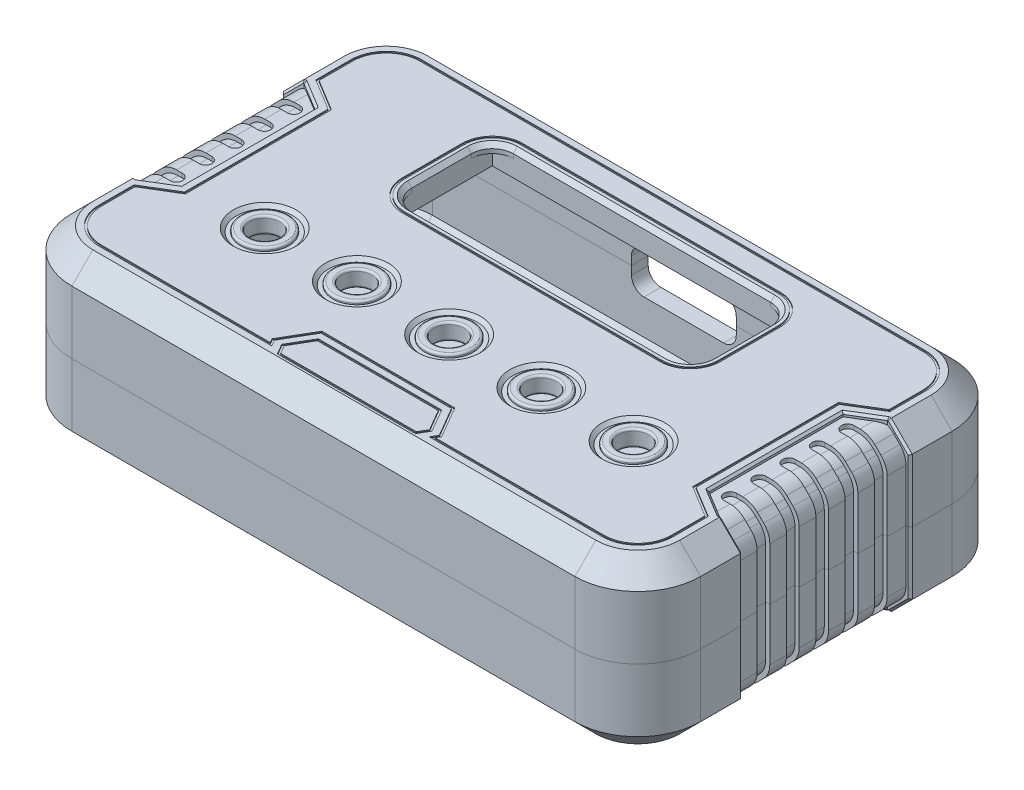
from build123d import *
from OCP.BRepFilletAPI import BRepFilletAPI_MakeChamfer

# Parameters (mm, degrees)
SKETCH1_W               = 150
SKETCH1_H               = 90
BOSS_EXTRUDE1_DEPTH     = 40
FILLET1_R               = 15
CHAMFER1_SIZE           = 5
SHELL7_T                = 4
CUT_EXTRUDE1_DEPTH      = 20
CUT_EXTRUDE2_DEPTH      = 1.5
FILLET2_R               = 1.5
FILLET4_R               = 1.5
LPATTERN1_COUNT         = 3
LPATTERN1_PITCH         = 7
FILLET2_OF_LPATTERN1_R  = 1.5
FILLET4_OF_LPATTERN1_R  = 1.5
LPATTERN2_COUNT         = 3
LPATTERN2_PITCH         = 7
FILLET2_OF_LPATTERN2_R  = 1.5
FILLET4_OF_LPATTERN2_R  = 1.5
CHAMFER5_SIZE           = 6.59
CHAMFER5_SIZE2          = 4
CHAMFER6_SIZE           = 4
CHAMFER6_SIZE2          = 6.59
CHAMFER7_SIZE           = 0.5
CUT_EXTRUDE_THIN2_DEPTH = 0.25
CUT_EXTRUDE_THIN3_DEPTH = 0.25
CUT_EXTRUDE3_REACH      = 125.794
CUT_EXTRUDE4_REACH      = 98.177
SKETCH18_W              = 71.4
SKETCH18_H              = 24.2
SKETCH18_R              = 3.6
FILLET16_R              = 5
CUT_EXTRUDE7_START      = -2
SKETCH18_6_W            = 71.4
SKETCH18_6_H            = 24.2
CUT_EXTRUDE7_DEPTH      = 10
BOSS_EXTRUDE5_START     = -4
SKETCH18_7_W            = 75.4
SKETCH18_7_H            = 28.2
SKETCH18_7_W_2          = 71.4
SKETCH18_7_H_2          = 24.2
BOSS_EXTRUDE5_DEPTH     = 2
CHAMFER8_SIZE           = 1
CUT_EXTRUDE_THIN4_DEPTH = 0.25
FILLET13_R              = 5
FILLET14_R              = 0.5
SKETCH23_R              = 7.5
SKETCH23_R_2            = 5.75
CUT_EXTRUDE10_DEPTH     = 0.8
FILLET17_R              = 0.5
CHAMFER9_SIZE           = 0.8


# Read off the part's stored shape, not the designer's step: Mirror12
with BuildPart() as part:
    # Sketch1 → Boss-Extrude1 (new body)
    with BuildSketch(Plane(origin=(0, 0, 0), x_dir=(1, 0, 0), z_dir=(0, 1, 0))):
        Rectangle(SKETCH1_W, SKETCH1_H)
    extrude(amount=BOSS_EXTRUDE1_DEPTH)

    # Fillet1
    fillet1_edges = [part.edges().sort_by_distance(p)[0] for p in [
        (75, 20, 45),
        (-75, 20, 45),
        (-75, 20, -45),
        (75, 20, -45),
    ]]
    fillet(fillet1_edges, radius=FILLET1_R)

    # Chamfer1
    chamfer1_edges = [part.edges().sort_by_distance(p)[0] for p in [
        (-75, 0, 0),
        (-75, 40, 0),
        (75, 0, 0),
        (0, 0, 45),
        (0, 0, -45),
        (-70.606601718, 0, 40.606601718),
        (70.606601718, 0, 40.606601718),
        (70.606601718, 0, -40.606601718),
        (-70.606601718, 0, -40.606601718),
        (0, 40, -45),
        (75, 40, 0),
        (0, 40, 45),
        (-70.606601718, 40, 40.606601718),
        (70.606601718, 40, 40.606601718),
        (70.606601718, 40, -40.606601718),
        (-70.606601718, 40, -40.606601718),
    ]]
    chamfer(chamfer1_edges, length=CHAMFER1_SIZE)

    # Shell7 (no face opened: a closed hollow body)
    add(offset(amount=-SHELL7_T, mode=Mode.PRIVATE), mode=Mode.SUBTRACT)

    # Sketch3 → Cut-Extrude1 (cut, symmetric)
    with BuildSketch(Plane.XY):
        Polygon((70, 40), (63, 40), (63, 39), (69.585786438, 39), (74, 34.585786438), (74, 5.414213562), (69.585786438, 1), (63, 1), (63, 0), (70, 0), (75, 5), (75, 35), align=None)
    extrude(amount=CUT_EXTRUDE1_DEPTH, both=True, mode=Mode.SUBTRACT)

    # Sketch12 → Cut-Extrude2 (cut, symmetric)
    with BuildSketch(Plane.XY):
        Polygon((69.585786438, 39), (64.585, 39), (64.585, 38), (69.171572875, 38), (73, 34.171572875), (73, 5.828427125), (69.171572875, 2), (64.585, 2), (64.585, 1), (69.585786438, 1), (74, 5.414213562), (74, 34.585786438), align=None)
    cut_extrude2 = extrude(amount=CUT_EXTRUDE2_DEPTH, both=True, mode=Mode.SUBTRACT)

    # Fillet2
    fillet2_edges = [part.edges().sort_by_distance(p)[0] for p in [
        (64.585, 38.5, -1.5),
        (64.585, 38.5, 1.5),
    ]]
    fillet(fillet2_edges, radius=FILLET2_R - 0.0001)  # a hair under: the kernel refuses the full size

    # Fillet4
    fillet4_edges = [part.edges().sort_by_distance(p)[0] for p in [
        (64.585, 1.5, -1.5),
        (64.585, 1.5, 1.5),
    ]]
    fillet(fillet4_edges, radius=FILLET4_R - 0.0001)  # a hair under: the kernel refuses the full size

    # LPattern1: Cut-Extrude2 ×3
    with Locations(*[(0, 0, i * LPATTERN1_PITCH) for i in range(1, LPATTERN1_COUNT)]):
        add(cut_extrude2, mode=Mode.SUBTRACT)

    # Fillet2 of LPattern1
    fillet2_of_lpattern1_edges = [part.edges().sort_by_distance(p)[0] for p in [
        (64.585, 38.5, 5.5),
        (64.585, 38.5, 8.5),
        (64.585, 38.5, 12.5),
        (64.585, 38.5, 15.5),
    ]]
    fillet(fillet2_of_lpattern1_edges, radius=FILLET2_OF_LPATTERN1_R - 0.0001)  # a hair under: the kernel refuses the full size

    # Fillet4 of LPattern1
    fillet4_of_lpattern1_edges = [part.edges().sort_by_distance(p)[0] for p in [
        (64.585, 1.5, 5.5),
        (64.585, 1.5, 8.5),
        (64.585, 1.5, 12.5),
        (64.585, 1.5, 15.5),
    ]]
    fillet(fillet4_of_lpattern1_edges, radius=FILLET4_OF_LPATTERN1_R - 0.0001)  # a hair under: the kernel refuses the full size

    # LPattern2: Cut-Extrude2 ×3
    with Locations(*[(0, 0, -i * LPATTERN2_PITCH) for i in range(1, LPATTERN2_COUNT)]):
        add(cut_extrude2, mode=Mode.SUBTRACT)

    # Fillet2 of LPattern2
    fillet2_of_lpattern2_edges = [part.edges().sort_by_distance(p)[0] for p in [
        (64.585, 38.5, -8.5),
        (64.585, 38.5, -5.5),
        (64.585, 38.5, -15.5),
        (64.585, 38.5, -12.5),
    ]]
    fillet(fillet2_of_lpattern2_edges, radius=FILLET2_OF_LPATTERN2_R - 0.0001)  # a hair under: the kernel refuses the full size

    # Fillet4 of LPattern2
    fillet4_of_lpattern2_edges = [part.edges().sort_by_distance(p)[0] for p in [
        (64.585, 1.5, -8.5),
        (64.585, 1.5, -5.5),
        (64.585, 1.5, -15.5),
        (64.585, 1.5, -12.5),
    ]]
    fillet(fillet4_of_lpattern2_edges, radius=FILLET4_OF_LPATTERN2_R - 0.0001)  # a hair under: the kernel refuses the full size

    # Mirror12
    split(bisect_by=Plane(origin=(0, 0, 0), x_dir=(0, 0, 1), z_dir=(1, 0, 0)), keep=Keep.TOP)

    # Mirror12 2: part across plane


with BuildPart() as part_1:
    add(part.part)
    add(part.part.mirror(Plane(origin=(0, 0, 0), x_dir=(0, 0, 1), z_dir=(1, 0, 0))))

    # Chamfer5: one chamfer whose edges measure the first distance from different faces: ONE call of the kernel's chamfer builder (chamfer() names one face for all edges)
    chamfer5_edges_1 = [part_1.edges().sort_by_distance(p)[0] for p in [
        (-63, 39.5, -20),
        (-63, 0.5, -20),
    ]]
    chamfer5_side_1 = [part_1.faces().sort_by_distance(p)[0] for p in [
        (-74.58238774, 20, -20),
    ]]
    chamfer5_edges_2 = [part_1.edges().sort_by_distance(p)[0] for p in [
        (63, 0.5, 20),
        (63, 39.5, 20),
    ]]
    chamfer5_side_2 = [part_1.faces().sort_by_distance(p)[0] for p in [
        (74.58238774, 20, 20),
    ]]
    chamfer5 = BRepFilletAPI_MakeChamfer(part_1.part.solid().wrapped)
    for e in chamfer5_edges_1:
        chamfer5.Add(CHAMFER5_SIZE, CHAMFER5_SIZE2, e.wrapped, chamfer5_side_1[0].wrapped)  # the first distance lies on this face
    for e in chamfer5_edges_2:
        chamfer5.Add(CHAMFER5_SIZE, CHAMFER5_SIZE2, e.wrapped, chamfer5_side_2[0].wrapped)  # the first distance lies on this face
    add(Compound.cast(chamfer5.Shape()), mode=Mode.REPLACE)

    # Chamfer6: one chamfer whose edges measure the first distance from different faces: ONE call of the kernel's chamfer builder (chamfer() names one face for all edges)
    chamfer6_edges_1 = [part_1.edges().sort_by_distance(p)[0] for p in [
        (-63, 0.5, 20),
    ]]
    chamfer6_side_1 = [part_1.faces().sort_by_distance(p)[0] for p in [
        (-63, 0.5, 2),
    ]]
    chamfer6_edges_2 = [part_1.edges().sort_by_distance(p)[0] for p in [
        (-63, 39.5, 20),
    ]]
    chamfer6_side_2 = [part_1.faces().sort_by_distance(p)[0] for p in [
        (-63, 39.5, 2),
    ]]
    chamfer6_edges_3 = [part_1.edges().sort_by_distance(p)[0] for p in [
        (63, 39.5, -20),
    ]]
    chamfer6_side_3 = [part_1.faces().sort_by_distance(p)[0] for p in [
        (63, 39.5, -2),
    ]]
    chamfer6_edges_4 = [part_1.edges().sort_by_distance(p)[0] for p in [
        (63, 0.5, -20),
    ]]
    chamfer6_side_4 = [part_1.faces().sort_by_distance(p)[0] for p in [
        (63, 0.5, -2),
    ]]
    chamfer6 = BRepFilletAPI_MakeChamfer(part_1.part.solid().wrapped)
    for e in chamfer6_edges_1:
        chamfer6.Add(CHAMFER6_SIZE, CHAMFER6_SIZE2, e.wrapped, chamfer6_side_1[0].wrapped)  # the first distance lies on this face
    for e in chamfer6_edges_2:
        chamfer6.Add(CHAMFER6_SIZE, CHAMFER6_SIZE2, e.wrapped, chamfer6_side_2[0].wrapped)  # the first distance lies on this face
    for e in chamfer6_edges_3:
        chamfer6.Add(CHAMFER6_SIZE, CHAMFER6_SIZE2, e.wrapped, chamfer6_side_3[0].wrapped)  # the first distance lies on this face
    for e in chamfer6_edges_4:
        chamfer6.Add(CHAMFER6_SIZE, CHAMFER6_SIZE2, e.wrapped, chamfer6_side_4[0].wrapped)  # the first distance lies on this face
    add(Compound.cast(chamfer6.Shape()), mode=Mode.REPLACE)

    # Chamfer7
    chamfer7_edges = [part_1.edges().sort_by_distance(p)[0] for p in [
        (72.5, 37.5, 20),
        (75, 20, 20),
        (72.5, 2.5, 20),
        (69.795, 0, 20),
        (72.5, 37.5, -20),
        (75, 20, -20),
        (72.5, 2.5, -20),
        (69.795, 0, -20),
        (-69.795, 0, -20),
        (-72.5, 2.5, -20),
        (-75, 20, -20),
        (-72.5, 37.5, -20),
        (-72.5, 37.5, 20),
        (-75, 20, 20),
        (-72.5, 2.5, 20),
        (-69.795, 0, 20),
        (-63, 40, 0),
        (-69.795, 40, -20),
        (-63, 0, 0),
        (69.795, 40, 20),
        (-66.295, 40, -18),
        (-66.295, 0, -18),
        (66.295, 0, 18),
        (66.295, 40, 18),
        (-69.795, 40, 20),
        (69.795, 40, -20),
        (63, 40, 0),
        (63, 0, 0),
        (-66.295, 0, 18),
        (-66.295, 40, 18),
        (66.295, 40, -18),
        (66.295, 0, -18),
    ]]
    chamfer(chamfer7_edges, length=CHAMFER7_SIZE)

    # Sketch15 → Cut-Extrude-Thin2 (cut, symmetric)
    with BuildSketch(Plane(origin=(0, 40, 0), x_dir=(1, 0, 0), z_dir=(0, 1, 0))):
        Polygon((-14.712814834, -31.5), (14.712814834, -31.5), (17.921148167, -37), (16.462814834, -39.5), (-16.462814834, -39.5), (-17.921148167, -37), align=None)
        Polygon((-14.425629668, -32), (14.425629668, -32), (17.342296334, -37), (16.175629668, -39), (-16.175629668, -39), (-17.342296334, -37), align=None, mode=Mode.SUBTRACT)
    extrude(amount=CUT_EXTRUDE_THIN2_DEPTH, both=True, mode=Mode.SUBTRACT)

    # Sketch16 → Cut-Extrude-Thin3 (cut, symmetric)
    with BuildSketch(Plane(origin=(0, 40, 0), x_dir=(1, 0, 0), z_dir=(0, 1, 0))):
        with BuildLine():
            Line((60, 38.5), (-60, 38.5))
            ThreePointArc((-60, 38.5), (-66.01040764, 36.01040764), (-68.5, 30))
            Line((-68.5, 30), (-68.5, 21.677985529))
            Line((-68.5, 21.677985529), (-61, 17.12563348))
            Line((-61, 17.12563348), (-61, -17.12563348))
            Line((-61, -17.12563348), (-68.5, -21.677985529))
            Line((-68.5, -21.677985529), (-68.5, -30))
            ThreePointArc((-68.5, -30), (-66.01040764, -36.01040764), (-60, -38.5))
            Line((-60, -38.5), (-18.782703666, -38.5))
            Line((-18.782703666, -38.5), (-19.657703666, -37))
            Line((-19.657703666, -37), (-15.574370332, -30))
            Line((-15.574370332, -30), (15.574370332, -30))
            Line((15.574370332, -30), (19.657703666, -37))
            Line((19.657703666, -37), (18.782703666, -38.5))
            Line((18.782703666, -38.5), (60, -38.5))
            ThreePointArc((60, -38.5), (66.01040764, -36.01040764), (68.5, -30))
            Line((68.5, -30), (68.5, -21.677985529))
            Line((68.5, -21.677985529), (61, -17.12563348))
            Line((61, -17.12563348), (61, 17.12563348))
            Line((61, 17.12563348), (68.5, 21.677985529))
            Line((68.5, 21.677985529), (68.5, 30))
            ThreePointArc((68.5, 30), (66.01040764, 36.01040764), (60, 38.5))
        make_face()
        with BuildLine():
            Line((60, 38), (-60, 38))
            ThreePointArc((-60, 38), (-65.656854249, 35.656854249), (-68, 30))
            Line((-68, 30), (-68, 21.959393899))
            Line((-68, 21.959393899), (-60.5, 17.40704185))
            Line((-60.5, 17.40704185), (-60.5, -17.40704185))
            Line((-60.5, -17.40704185), (-68, -21.959393899))
            Line((-68, -21.959393899), (-68, -30))
            ThreePointArc((-68, -30), (-65.656854249, -35.656854249), (-60, -38))
            Line((-60, -38), (-19.653222165, -38))
            Line((-19.653222165, -38), (-20.236555499, -37))
            Line((-20.236555499, -37), (-15.861555499, -29.5))
            Line((-15.861555499, -29.5), (15.861555499, -29.5))
            Line((15.861555499, -29.5), (20.236555499, -37))
            Line((20.236555499, -37), (19.653222165, -38))
            Line((19.653222165, -38), (60, -38))
            ThreePointArc((60, -38), (65.656854249, -35.656854249), (68, -30))
            Line((68, -30), (68, -21.959393899))
            Line((68, -21.959393899), (60.5, -17.40704185))
            Line((60.5, -17.40704185), (60.5, 17.40704185))
            Line((60.5, 17.40704185), (68, 21.959393899))
            Line((68, 21.959393899), (68, 30))
            ThreePointArc((68, 30), (65.656854249, 35.656854249), (60, 38))
        make_face(mode=Mode.SUBTRACT)
    extrude(amount=CUT_EXTRUDE_THIN3_DEPTH, both=True, mode=Mode.SUBTRACT)

    # Sketch17 → Cut-Extrude3 (cut, up to next)
    with BuildSketch(Plane(origin=(0, 0, -45), x_dir=(-1, 0, 0), z_dir=(0, 0, -1)), mode=Mode.PRIVATE) as cut_extrude3_sk1:
        with BuildLine():
            Line((-9.5, 15), (9.5, 15))
            ThreePointArc((9.5, 15), (11.621320344, 15.878679656), (12.5, 18))
            Line((12.5, 18), (12.5, 22))
            ThreePointArc((12.5, 22), (11.621320344, 24.121320344), (9.5, 25))
            Line((9.5, 25), (-9.5, 25))
            ThreePointArc((-9.5, 25), (-11.621320344, 24.121320344), (-12.5, 22))
            Line((-12.5, 22), (-12.5, 18))
            ThreePointArc((-12.5, 18), (-11.621320344, 15.878679656), (-9.5, 15))
        make_face()
    cut_extrude3_tool1 = extrude(cut_extrude3_sk1.sketch, amount=-CUT_EXTRUDE3_REACH, mode=Mode.PRIVATE) & part_1.part
    add(cut_extrude3_tool1.solids().sort_by_distance((0, 20, -45))[0], mode=Mode.SUBTRACT)

    # Sketch18 → Cut-Extrude4 (cut, up to next)
    with BuildSketch(Plane(origin=(0, 40, 0), x_dir=(1, 0, 0), z_dir=(0, 1, 0)), mode=Mode.PRIVATE) as cut_extrude4_sk1:
        with Locations((0, 18.9)):
            Rectangle(SKETCH18_W, SKETCH18_H)
    cut_extrude4_tool1 = extrude(cut_extrude4_sk1.sketch, amount=-CUT_EXTRUDE4_REACH, mode=Mode.PRIVATE) & part_1.part
    # Sketch18 → Cut-Extrude4 (cut, up to next)
    with BuildSketch(Plane(origin=(0, 40, 0), x_dir=(1, 0, 0), z_dir=(0, 1, 0)), mode=Mode.PRIVATE) as cut_extrude4_sk2:
        with Locations(Location((-44, -15, 0), (0, 0, 270))):
            Circle(SKETCH18_R)
    cut_extrude4_tool2 = extrude(cut_extrude4_sk2.sketch, amount=-CUT_EXTRUDE4_REACH, mode=Mode.PRIVATE) & part_1.part
    # Sketch18 → Cut-Extrude4 (cut, up to next)
    with BuildSketch(Plane(origin=(0, 40, 0), x_dir=(1, 0, 0), z_dir=(0, 1, 0)), mode=Mode.PRIVATE) as cut_extrude4_sk3:
        with Locations(Location((-22, -15, 0), (0, 0, 270))):
            Circle(SKETCH18_R)
    cut_extrude4_tool3 = extrude(cut_extrude4_sk3.sketch, amount=-CUT_EXTRUDE4_REACH, mode=Mode.PRIVATE) & part_1.part
    # Sketch18 → Cut-Extrude4 (cut, up to next)
    with BuildSketch(Plane(origin=(0, 40, 0), x_dir=(1, 0, 0), z_dir=(0, 1, 0)), mode=Mode.PRIVATE) as cut_extrude4_sk4:
        with Locations(Location((0, -15, 0), (0, 0, 270))):
            Circle(SKETCH18_R)
    cut_extrude4_tool4 = extrude(cut_extrude4_sk4.sketch, amount=-CUT_EXTRUDE4_REACH, mode=Mode.PRIVATE) & part_1.part
    # Sketch18 → Cut-Extrude4 (cut, up to next)
    with BuildSketch(Plane(origin=(0, 40, 0), x_dir=(1, 0, 0), z_dir=(0, 1, 0)), mode=Mode.PRIVATE) as cut_extrude4_sk5:
        with Locations(Location((22, -15, 0), (0, 0, 270))):
            Circle(SKETCH18_R)
    cut_extrude4_tool5 = extrude(cut_extrude4_sk5.sketch, amount=-CUT_EXTRUDE4_REACH, mode=Mode.PRIVATE) & part_1.part
    # Sketch18 → Cut-Extrude4 (cut, up to next)
    with BuildSketch(Plane(origin=(0, 40, 0), x_dir=(1, 0, 0), z_dir=(0, 1, 0)), mode=Mode.PRIVATE) as cut_extrude4_sk6:
        with Locations(Location((44, -15, 0), (0, 0, 270))):
            Circle(SKETCH18_R)
    cut_extrude4_tool6 = extrude(cut_extrude4_sk6.sketch, amount=-CUT_EXTRUDE4_REACH, mode=Mode.PRIVATE) & part_1.part
    add(cut_extrude4_tool1.solids().sort_by_distance((0, 40, -18.9))[0], mode=Mode.SUBTRACT)
    add(cut_extrude4_tool2.solids().sort_by_distance((-44, 40, 15))[0], mode=Mode.SUBTRACT)
    add(cut_extrude4_tool3.solids().sort_by_distance((-22, 40, 15))[0], mode=Mode.SUBTRACT)
    add(cut_extrude4_tool4.solids().sort_by_distance((0, 40, 15))[0], mode=Mode.SUBTRACT)
    add(cut_extrude4_tool5.solids().sort_by_distance((22, 40, 15))[0], mode=Mode.SUBTRACT)
    add(cut_extrude4_tool6.solids().sort_by_distance((44, 40, 15))[0], mode=Mode.SUBTRACT)

    # Fillet16
    fillet16_edges = [part_1.edges().sort_by_distance(p)[0] for p in [
        (-35.7, 38, -6.8),
        (-35.7, 38, -31),
        (35.7, 38, -31),
        (35.7, 38, -6.8),
    ]]
    fillet(fillet16_edges, radius=FILLET16_R)

    # Sketch18<6> → Cut-Extrude7 (cut)
    with BuildSketch(Plane(origin=(0, 40, 0), x_dir=(1, 0, 0), z_dir=(0, 1, 0)).offset(CUT_EXTRUDE7_START)):
        with Locations((0, 18.9)):
            Rectangle(SKETCH18_6_W, SKETCH18_6_H)
    extrude(amount=-CUT_EXTRUDE7_DEPTH, mode=Mode.SUBTRACT)

    # Sketch18<7> → Boss-Extrude5 (add)
    with BuildSketch(Plane(origin=(0, 40, 0), x_dir=(1, 0, 0), z_dir=(0, 1, 0)).offset(BOSS_EXTRUDE5_START)):
        with Locations((0, 18.9)):
            Rectangle(SKETCH18_7_W, SKETCH18_7_H)
        with Locations((0, 18.9)):
            Rectangle(SKETCH18_7_W_2, SKETCH18_7_H_2, mode=Mode.SUBTRACT)
    extrude(amount=-BOSS_EXTRUDE5_DEPTH)

    # Chamfer8
    chamfer8_edges = [part_1.edges().sort_by_distance(p)[0] for p in [
        (35.7, 40, -18.9),
        (0, 40, -6.8),
        (0, 40, -31),
        (-35.7, 40, -18.9),
        (34.235533906, 40, -8.264466094),
        (34.235533906, 40, -29.535533906),
        (-34.235533906, 40, -8.264466094),
        (-34.235533906, 40, -29.535533906),
    ]]
    chamfer(chamfer8_edges, length=CHAMFER8_SIZE)

    # Sketch26 → Cut-Extrude-Thin4 (cut)
    with BuildSketch(Plane(origin=(0, 40, 0), x_dir=(1, 0, 0), z_dir=(0, 1, 0))):
        with BuildLine():
            Line((-37.95, 11.8), (-37.95, 26))
            ThreePointArc((-37.95, 26), (-35.826524164, 31.126524164), (-30.7, 33.25))
            Line((-30.7, 33.25), (30.7, 33.25))
            ThreePointArc((30.7, 33.25), (35.826524164, 31.126524164), (37.95, 26))
            Line((37.95, 26), (37.95, 11.8))
            ThreePointArc((37.95, 11.8), (35.826524164, 6.673475836), (30.7, 4.55))
            Line((30.7, 4.55), (-30.7, 4.55))
            ThreePointArc((-30.7, 4.55), (-35.826524164, 6.673475836), (-37.95, 11.8))
        make_face()
        with BuildLine():
            Line((-37.45, 11.8), (-37.45, 26))
            ThreePointArc((-37.45, 26), (-35.472970773, 30.772970773), (-30.7, 32.75))
            Line((-30.7, 32.75), (30.7, 32.75))
            ThreePointArc((30.7, 32.75), (35.472970773, 30.772970773), (37.45, 26))
            Line((37.45, 26), (37.45, 11.8))
            ThreePointArc((37.45, 11.8), (35.472970773, 7.027029227), (30.7, 5.05))
            Line((30.7, 5.05), (-30.7, 5.05))
            ThreePointArc((-30.7, 5.05), (-35.472970773, 7.027029227), (-37.45, 11.8))
        make_face(mode=Mode.SUBTRACT)
    extrude(amount=-CUT_EXTRUDE_THIN4_DEPTH, mode=Mode.SUBTRACT)

    # Fillet13
    fillet13_edges = [part_1.edges().sort_by_distance(p)[0] for p in [
        (69.585786438, 1, -17.748721225),
        (69.585786438, 1, -10.5),
        (69.585786438, 1, -3.5),
        (69.585786438, 1, 3.5),
        (69.585786438, 1, 10.5),
        (69.585786438, 1, 17.748721225),
        (74, 5.414213562, 17.75),
        (74, 5.414213562, 10.5),
        (74, 5.414213562, 3.5),
        (74, 5.414213562, -3.5),
        (74, 5.414213562, -10.5),
        (74, 5.414213562, -17.75),
        (74, 34.585786438, 17.75),
        (74, 34.585786438, 10.5),
        (74, 34.585786438, 3.5),
        (74, 34.585786438, -3.5),
        (74, 34.585786438, -10.5),
        (74, 34.585786438, -17.75),
        (69.585786438, 39, 17.748721225),
        (69.585786438, 39, 10.5),
        (69.585786438, 39, 3.5),
        (69.585786438, 39, -3.5),
        (69.585786438, 39, -10.5),
        (69.585786438, 39, -17.748721225),
        (-74, 5.414213562, 17.75),
        (-69.585786438, 1, 17.748721225),
        (-74, 5.414213562, 10.5),
        (-69.585786438, 1, 10.5),
        (-74, 5.414213562, 3.5),
        (-69.585786438, 1, 3.5),
        (-74, 5.414213562, -3.5),
        (-69.585786438, 1, -3.5),
        (-74, 5.414213562, -10.5),
        (-69.585786438, 1, -10.5),
        (-69.585786438, 1, -17.748721225),
        (-74, 5.414213562, -17.75),
        (-74, 34.585786438, -17.75),
        (-74, 34.585786438, -10.5),
        (-74, 34.585786438, -3.5),
        (-74, 34.585786438, 3.5),
        (-74, 34.585786438, 10.5),
        (-74, 34.585786438, 17.75),
        (-69.585786438, 39, 17.748721225),
        (-69.585786438, 39, 10.5),
        (-69.585786438, 39, 3.5),
        (-69.585786438, 39, -17.748721225),
        (-69.585786438, 39, -10.5),
        (-69.585786438, 39, -3.5),
        (-69.171572875, 2, 0),
        (-73, 5.828427125, 0),
        (-69.171572875, 2, -7),
        (-73, 5.828427125, -7),
        (-69.171572875, 2, -14),
        (-73, 5.828427125, -14),
        (-69.171572875, 2, 7),
        (-73, 5.828427125, 7),
        (-69.171572875, 2, 14),
        (-73, 5.828427125, 14),
        (-73, 34.171572875, 14),
        (-69.171572875, 38, 14),
        (-73, 34.171572875, 7),
        (-69.171572875, 38, 7),
        (-73, 34.171572875, 0),
        (-69.171572875, 38, 0),
        (-73, 34.171572875, -7),
        (-69.171572875, 38, -7),
        (-69.171572875, 38, -14),
        (-73, 34.171572875, -14),
        (69.171572875, 2, 14),
        (73, 5.828427125, 14),
        (69.171572875, 2, 7),
        (73, 5.828427125, 7),
        (69.171572875, 2, 0),
        (73, 5.828427125, 0),
        (69.171572875, 2, -7),
        (73, 5.828427125, -7),
        (69.171572875, 2, -14),
        (73, 5.828427125, -14),
        (73, 34.171572875, 14),
        (69.171572875, 38, 14),
        (73, 34.171572875, 7),
        (69.171572875, 38, 7),
        (73, 34.171572875, 0),
        (69.171572875, 38, 0),
        (73, 34.171572875, -7),
        (69.171572875, 38, -7),
        (73, 34.171572875, -14),
        (69.171572875, 38, -14),
    ]]
    fillet(fillet13_edges, radius=FILLET13_R)

    # Fillet14
    fillet14_edges = [part_1.edges().sort_by_distance(p)[0] for p in [
        (-44, 36, 11.4),
        (-44, 40, 11.4),
        (-22, 36, 11.4),
        (-22, 40, 11.4),
        (0, 36, 11.4),
        (0, 40, 11.4),
        (22, 36, 11.4),
        (22, 40, 11.4),
        (44, 36, 11.4),
        (44, 40, 11.4),
    ]]
    fillet(fillet14_edges, radius=FILLET14_R)

    # Sketch23 → Cut-Extrude10 (cut)
    # profile 1 of 5: a face of its own
    with BuildSketch(Plane(origin=(0, 40, 0), x_dir=(1, 0, 0), z_dir=(0, 1, 0))):
        with Locations(Location((-44, -15, 0), (0, 0, 270))):
            Circle(SKETCH23_R)
        with Locations(Location((-44, -15, 0), (0, 0, 270))):
            Circle(SKETCH23_R_2, mode=Mode.SUBTRACT)
    # profile 2 of 5: a face of its own
    with BuildSketch(Plane(origin=(0, 40, 0), x_dir=(1, 0, 0), z_dir=(0, 1, 0))):
        with Locations(Location((-22, -15, 0), (0, 0, 270))):
            Circle(SKETCH23_R)
        with Locations(Location((-22, -15, 0), (0, 0, 270))):
            Circle(SKETCH23_R_2, mode=Mode.SUBTRACT)
    # profile 3 of 5: a face of its own
    with BuildSketch(Plane(origin=(0, 40, 0), x_dir=(1, 0, 0), z_dir=(0, 1, 0))):
        with Locations(Location((0, -15, 0), (0, 0, 270))):
            Circle(SKETCH23_R)
        with Locations(Location((0, -15, 0), (0, 0, 270))):
            Circle(SKETCH23_R_2, mode=Mode.SUBTRACT)
    # profile 4 of 5: a face of its own
    with BuildSketch(Plane(origin=(0, 40, 0), x_dir=(1, 0, 0), z_dir=(0, 1, 0))):
        with Locations(Location((22, -15, 0), (0, 0, 270))):
            Circle(SKETCH23_R)
        with Locations(Location((22, -15, 0), (0, 0, 270))):
            Circle(SKETCH23_R_2, mode=Mode.SUBTRACT)
    # profile 5 of 5: a face of its own
    with BuildSketch(Plane(origin=(0, 40, 0), x_dir=(1, 0, 0), z_dir=(0, 1, 0))):
        with Locations(Location((44, -15, 0), (0, 0, 270))):
            Circle(SKETCH23_R)
        with Locations(Location((44, -15, 0), (0, 0, 270))):
            Circle(SKETCH23_R_2, mode=Mode.SUBTRACT)
    extrude(amount=-CUT_EXTRUDE10_DEPTH, mode=Mode.SUBTRACT)

    # Fillet17
    fillet17_edges = [part_1.edges().sort_by_distance(p)[0] for p in [
        (-44, 40, 9.25),
        (-22, 40, 9.25),
        (0, 40, 9.25),
        (22, 40, 9.25),
        (44, 40, 9.25),
    ]]
    fillet(fillet17_edges, radius=FILLET17_R)

    # Chamfer9
    chamfer9_edges = [part_1.edges().sort_by_distance(p)[0] for p in [
        (-44, 39.2, 7.5),
        (-22, 39.2, 7.5),
        (0, 39.2, 7.5),
        (22, 39.2, 7.5),
        (44, 39.2, 7.5),
    ]]
    chamfer(chamfer9_edges, length=CHAMFER9_SIZE - 0.0001)  # a hair under: the kernel refuses the full size


with BuildPart() as body_2:
    # Split1: the piece on the far side of the plane
    add(part_1.part)
    split(bisect_by=Plane.ZX.offset(20), keep=Keep.BOTTOM)


with BuildPart() as part_2:
    add(part_1.part)

    # Split1
    split(bisect_by=Plane.ZX.offset(20), keep=Keep.TOP)


solid = Compound([body_2.part, part_2.part])
